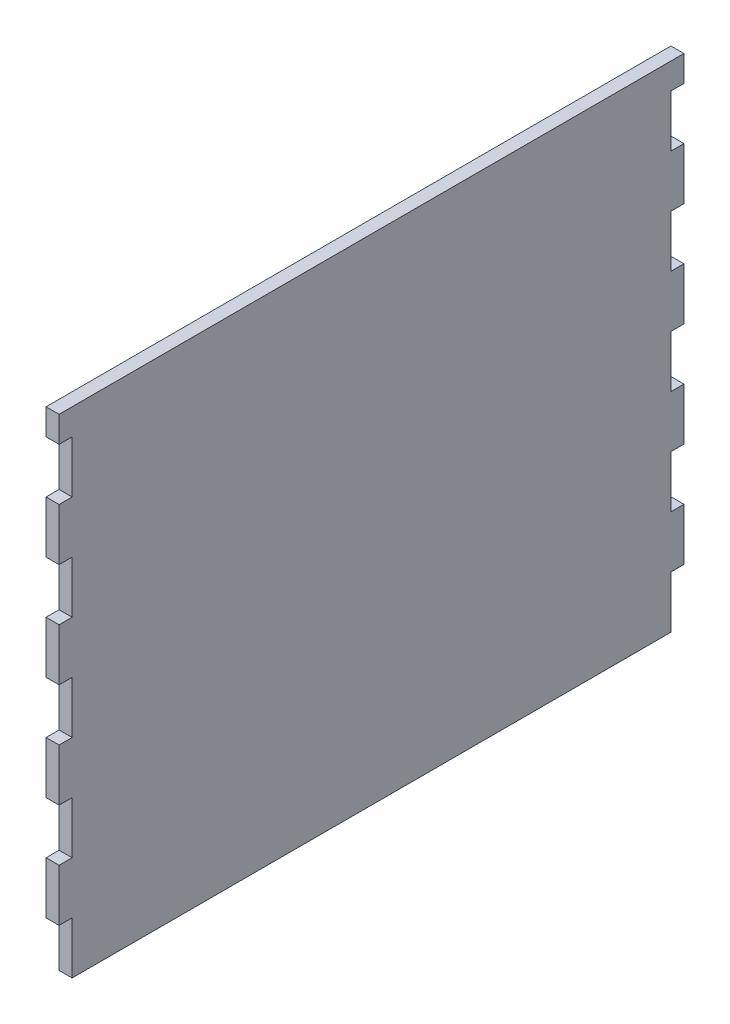
from build123d import *

# Parameters (mm, degrees)
SKETCH1_W           = 304.8
SKETCH1_H           = 241.3
BOSS_EXTRUDE4_DEPTH = 6.35
SKETCH2_W           = 6.35
SKETCH2_H           = 25.4
CUT_EXTRUDE3_DEPTH  = 7.62
SKETCH3_W           = 6.35
SKETCH3_H           = 25.470512821
SKETCH3_H_2         = 25.4
CUT_EXTRUDE4_DEPTH  = 7.62


with BuildPart() as part:
    # Sketch1 → Boss-Extrude4 (new body)
    with BuildSketch(Plane(origin=(0, 0, 0), x_dir=(0, 0, -1), z_dir=(1, 0, 0))):
        with Locations((-173.678767452, 29.972488533)):
            Rectangle(SKETCH1_W, SKETCH1_H)
    extrude(amount=BOSS_EXTRUDE4_DEPTH)

    # Sketch2 → Cut-Extrude3 (cut)
    with BuildSketch(Plane(origin=(6.35, 0, 0), x_dir=(0, 0, -1), z_dir=(1, 0, 0))):
        with Locations((-322.903767452, -77.977511467)):
            Rectangle(SKETCH2_W, SKETCH2_H)
        with Locations((-322.903767452, -27.177511467)):
            Rectangle(SKETCH2_W, SKETCH2_H)
        with Locations((-322.903767452, 23.622488533)):
            Rectangle(SKETCH2_W, SKETCH2_H)
        with Locations((-322.903767452, 74.422488533)):
            Rectangle(SKETCH2_W, SKETCH2_H)
        with Locations((-322.903767452, 125.222488533)):
            Rectangle(SKETCH2_W, SKETCH2_H)
    extrude(amount=-CUT_EXTRUDE3_DEPTH, mode=Mode.SUBTRACT)

    # Sketch3 → Cut-Extrude4 (cut)
    with BuildSketch(Plane.ZY):
        with Locations((24.453767452, -77.942255057)):
            Rectangle(SKETCH3_W, SKETCH3_H)
        with Locations((24.453767452, -27.106998646)):
            Rectangle(SKETCH3_W, SKETCH3_H_2)
        with Locations((24.453767452, 23.693001354)):
            Rectangle(SKETCH3_W, SKETCH3_H_2)
        with Locations((24.453767452, 74.493001354)):
            Rectangle(SKETCH3_W, SKETCH3_H_2)
        with Locations((24.453767452, 125.293001354)):
            Rectangle(SKETCH3_W, SKETCH3_H_2)
    extrude(amount=-CUT_EXTRUDE4_DEPTH, mode=Mode.SUBTRACT)


solid = part.part
